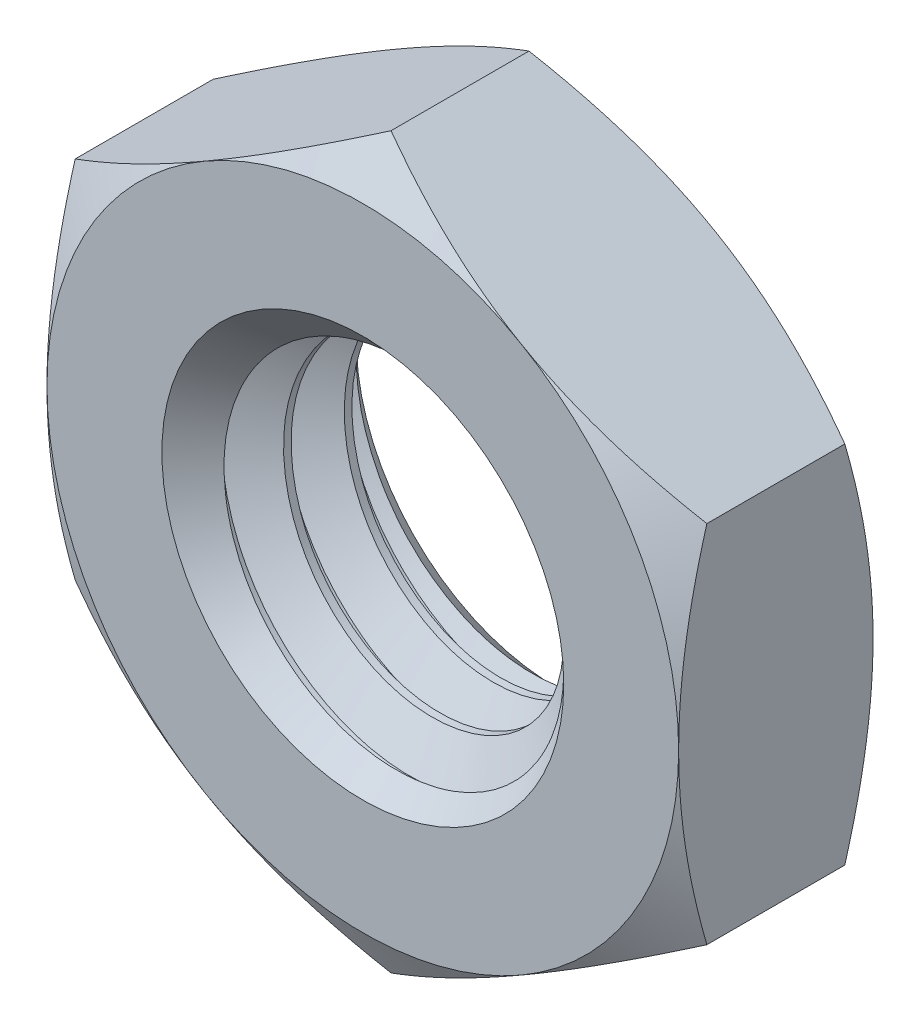
from build123d import *

# Parameters (mm, degrees)
BOSS_EXTRUDE1_START          = 2
SKETCH3_R                    = 4
BOSS_EXTRUDE1_DEPTH          = 4
CUT_EXTRUDE1_START           = 2
SKETCH4_OUTSIDE_W            = 64.53
SKETCH4_OUTSIDE_H            = 66.542
SKETCH4_OUTSIDE_R            = 6.5
CUT_EXTRUDE1_DEPTH           = 13.128343069
CUT_EXTRUDE1_DRAFT           = -60
CUT_EXTRUDE2_START           = -2
SKETCH5_OUTSIDE_W            = 64.53
SKETCH5_OUTSIDE_H            = 66.542
SKETCH5_OUTSIDE_R            = 6.5
CUT_EXTRUDE2_DEPTH           = 13.128343069
CUT_EXTRUDE2_DRAFT           = 60
SWEEP1_PITCH                 = 1.25
CUT_EXTRUDE3_START           = 2
SKETCH8_R                    = 4.135316469
CUT_EXTRUDE3_OTHER_WAY_DEPTH = 11.459506079
CUT_EXTRUDE3_OTHER_WAY_TAPER = -45
CUT_EXTRUDE4_START           = -2
SKETCH9_R                    = 4.135316469
CUT_EXTRUDE4_DEPTH           = 13.459506079
CUT_EXTRUDE4_TAPER           = 45
CUT_EXTRUDE4_OTHER_WAY_DEPTH = 11.459506079
CUT_EXTRUDE4_OTHER_WAY_TAPER = -45


with BuildPart() as part:
    # Sketch3 → Boss-Extrude1 (new body)
    with BuildSketch(Plane.XY.offset(BOSS_EXTRUDE1_START)):
        Polygon((-6.5, -3.75277675), (0, -7.505553499), (6.5, -3.75277675), (6.5, 3.75277675), (0, 7.505553499), (-6.5, 3.75277675), align=None)
        Circle(SKETCH3_R, mode=Mode.SUBTRACT)
    extrude(amount=-BOSS_EXTRUDE1_DEPTH)


with BuildPart() as cut_extrude1_tool:
    # Sketch4 outside → Cut-Extrude1 (with draft: the straight prism first)
    with BuildSketch(Plane.XY.offset(CUT_EXTRUDE1_START)):
        Rectangle(SKETCH4_OUTSIDE_W, SKETCH4_OUTSIDE_H)
        Circle(SKETCH4_OUTSIDE_R, mode=Mode.SUBTRACT)
    extrude(amount=-CUT_EXTRUDE1_DEPTH)
    # Cut-Extrude1: the draft: its side faces are tilted about the plane it starts from
    cut_extrude1_sides = [cut_extrude1_tool.faces().sort_by_distance(p)[0] for p in [
        (0, -33.271, -4.564171535),
        (32.265, 0, -4.564171535),
        (0, 33.271, -4.564171535),
        (-32.265, 0, -4.564171535),
        (-6.5, 0, -4.564171535),
    ]]
    draft(cut_extrude1_sides, Plane.XY.offset(CUT_EXTRUDE1_START), CUT_EXTRUDE1_DRAFT)


with BuildPart() as part_1:
    add(part.part)

    # Cut-Extrude1: cut by cut_extrude1_tool
    add(cut_extrude1_tool.part, mode=Mode.SUBTRACT)


with BuildPart() as cut_extrude2_tool:
    # Sketch5 outside → Cut-Extrude2 (with draft: the straight prism first)
    with BuildSketch(Plane.XY.offset(CUT_EXTRUDE2_START)):
        Rectangle(SKETCH5_OUTSIDE_W, SKETCH5_OUTSIDE_H)
        Circle(SKETCH5_OUTSIDE_R, mode=Mode.SUBTRACT)
    extrude(amount=CUT_EXTRUDE2_DEPTH)
    # Cut-Extrude2: the draft: its side faces are tilted about the plane it starts from
    cut_extrude2_sides = [cut_extrude2_tool.faces().sort_by_distance(p)[0] for p in [
        (0, -33.271, 4.564171535),
        (32.265, 0, 4.564171535),
        (0, 33.271, 4.564171535),
        (-32.265, 0, 4.564171535),
        (-6.5, 0, 4.564171535),
    ]]
    draft(cut_extrude2_sides, Plane.XY.offset(CUT_EXTRUDE2_START), CUT_EXTRUDE2_DRAFT)


with BuildPart() as part_2:
    add(part_1.part)

    # Cut-Extrude2: cut by cut_extrude2_tool
    add(cut_extrude2_tool.part, mode=Mode.SUBTRACT)

    # Sweep1: the profile of Sketch7 screwed along a right-hand helix of 4.2 turns, 8 arcs to a turn; built about Z, then put on its axis
    sweep1_z = Axis((0, 0, 0), (0, 0, 1))
    sweep1_corners = [(4.067658235, 0, -1.1328125), (3.188101184, 0, -0.625), (3.188101184, 0, -0.46875), (4.067658235, 0, 0.0390625)]
    with BuildLine(mode=Mode.PRIVATE) as sweep1_profile:
        Line(sweep1_corners[0], sweep1_corners[1])
        Line(sweep1_corners[1], sweep1_corners[2])
        Line(sweep1_corners[2], sweep1_corners[3])
        Line(sweep1_corners[3], sweep1_corners[0])
    sweep1_cap = Face(sweep1_profile.wire())
    sweep1_turn_angles = [0, 22.5, 45, 67.5, 90, 112.5, 135, 157.5, 180, 202.5, 225, 247.5, 270, 292.5, 315, 337.5, 360]
    sweep1_turn_weights = [1, 0.9238795325112867, 1, 0.9238795325112867, 1, 0.9238795325112867, 1, 0.9238795325112867, 1, 0.9238795325112867, 1, 0.9238795325112867, 1, 0.9238795325112867, 1, 0.9238795325112867, 1]
    sweep1_turn_rails = [Edge.make_bspline([Vector(p[0], p[1], 0).rotate(sweep1_z, sweep1_turn_angles[k]) / sweep1_turn_weights[k] + Vector(0, 0, p[2] + SWEEP1_PITCH * sweep1_turn_angles[k] / 360) for k in range(17)], [0, 0, 0, 1, 1, 2, 2, 3, 3, 4, 4, 5, 5, 6, 6, 7, 7, 8, 8, 8], 2, sweep1_turn_weights) for p in sweep1_corners]
    sweep1_turn_sides = [Face.make_surface_from_curves(sweep1_turn_rails[p[0]], sweep1_turn_rails[p[1]]) for p in [(0, 1), (1, 2), (2, 3), (3, 0)]]
    sweep1_last_angles = [1440, 1462.5, 1485, 1498.5, 1512]
    sweep1_last_weights = [1, 0.9238795325112867, 1, 0.9723699203976706, 1]
    sweep1_last_rails = [Edge.make_bspline([Vector(p[0], p[1], 0).rotate(sweep1_z, sweep1_last_angles[k]) / sweep1_last_weights[k] + Vector(0, 0, p[2] + SWEEP1_PITCH * sweep1_last_angles[k] / 360) for k in range(5)], [0, 0, 0, 1, 1, 2, 2, 2], 2, sweep1_last_weights) for p in sweep1_corners]
    sweep1_last_sides = [Face.make_surface_from_curves(sweep1_last_rails[p[0]], sweep1_last_rails[p[1]]) for p in [(0, 1), (1, 2), (2, 3), (3, 0)]]
    sweep1 = Plane(origin=(0, 0, 2), x_dir=(0, 1, 0), z_dir=(0, 0, -1)) * Solid(Shell([*[p.moved(Location((0, 0, SWEEP1_PITCH * i))) for i in range(4) for p in sweep1_turn_sides], *sweep1_last_sides, sweep1_cap, sweep1_cap.rotate(sweep1_z, 1512).moved(Location((0, 0, SWEEP1_PITCH * 1512 / 360)))]))
    add(sweep1)

    # Cut-Extrude3 cone 1 section (through the dimple's axis) → Cut-Extrude3 (revolve, cut)
    with BuildSketch(Plane(origin=(0, 0, 2), x_dir=(0, -1, 0), z_dir=(1, 0, 0))):
        Polygon((0, 0), (4.135316469, 0), (0, 4.135316469), align=None)
    revolve(axis=Axis((0, 0, 2), (0, 0, -1)), mode=Mode.SUBTRACT)

    # Sketch8 → Cut-Extrude3 other way (cut)
    with BuildSketch(Plane.XY.offset(CUT_EXTRUDE3_START)):
        Circle(SKETCH8_R)
    extrude(amount=CUT_EXTRUDE3_OTHER_WAY_DEPTH, taper=CUT_EXTRUDE3_OTHER_WAY_TAPER, mode=Mode.SUBTRACT)

    # Sketch9 → Cut-Extrude4 (cut)
    with BuildSketch(Plane.XY.offset(CUT_EXTRUDE4_START)):
        Circle(SKETCH9_R)
    extrude(amount=CUT_EXTRUDE4_DEPTH, taper=CUT_EXTRUDE4_TAPER, mode=Mode.SUBTRACT)

    # Sketch9 → Cut-Extrude4 other way (cut)
    with BuildSketch(Plane.XY.offset(CUT_EXTRUDE4_START)):
        Circle(SKETCH9_R)
    extrude(amount=-CUT_EXTRUDE4_OTHER_WAY_DEPTH, taper=CUT_EXTRUDE4_OTHER_WAY_TAPER, mode=Mode.SUBTRACT)


solid = part_2.part
